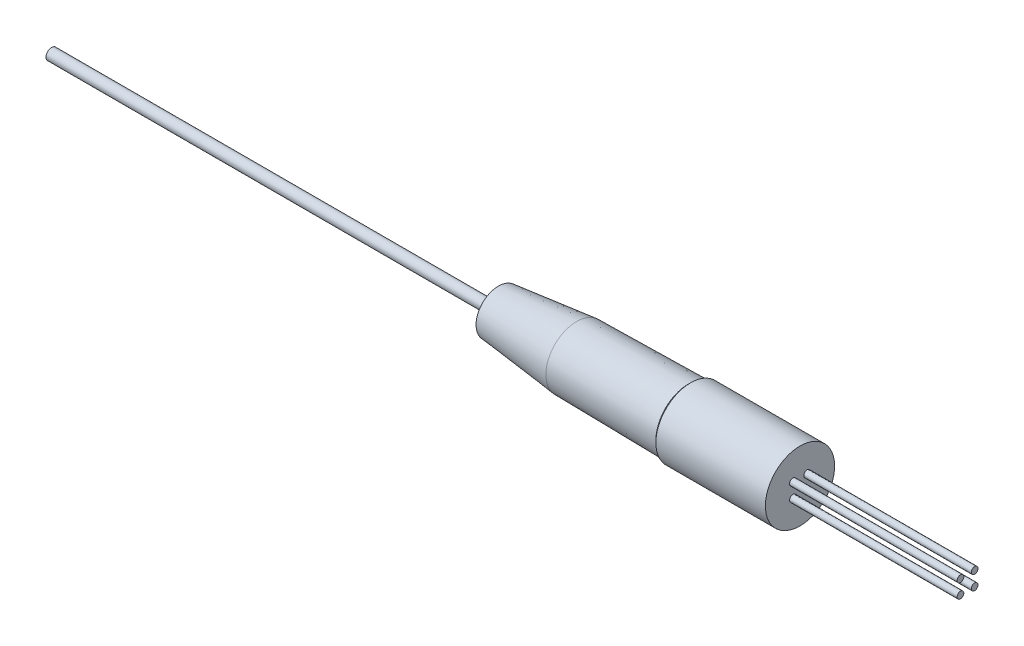
from build123d import *

# Parameters (mm, degrees)
CHAMFER_1_SIZE  = 0.2
SKETCH_5_R      = 0.3
EXTRUDE_2_DEPTH = 15
SKETCH_6_R      = 0.5
EXTRUDE_1_DEPTH = 40


# Read off the part's stored shape, not the designer's step: 旋转2
with BuildPart() as part:
    # 旋转2 outline → 旋转2 (revolve)
    with BuildSketch(Plane.YX):
        Polygon((3.1, 0), (0, 0), (0, -27), (2, -27), (2.75, -20), (2.9, -10), (3.1, -10), align=None)
    revolve(axis=Axis((0, 0, 0), (1, 0, 0)))

    # 倒角1
    chamfer_1_edges = [part.edges().sort_by_distance(p)[0] for p in [
        (-10, -3.1, 0),
    ]]
    chamfer(chamfer_1_edges, length=CHAMFER_1_SIZE - 0.0001)  # a hair under: the kernel refuses the full size

    # 草图5 → 拉伸2 (add)
    with BuildSketch(Plane(origin=(0, 0, 0), x_dir=(0, 0, -1), z_dir=(1, 0, 0))):
        with Locations(Location((-0.635, 0.635, 0), (0, 0, 270))):
            Circle(SKETCH_5_R)
        with Locations(Location((-0.635, -0.635, 0), (0, 0, 270))):
            Circle(SKETCH_5_R)
        with Locations(Location((0.635, 0.635, 0), (0, 0, 270))):
            Circle(SKETCH_5_R)
        with Locations(Location((0.635, -0.635, 0), (0, 0, 270))):
            Circle(SKETCH_5_R)
    extrude(amount=EXTRUDE_2_DEPTH)

    # 草图6 → Extrude 1 (add)
    with BuildSketch(Plane.ZY.offset(27)):
        with Locations(Location((0, 0, 0), (0, 0, 90))):
            Circle(SKETCH_6_R)
    extrude(amount=EXTRUDE_1_DEPTH)


solid = part.part
